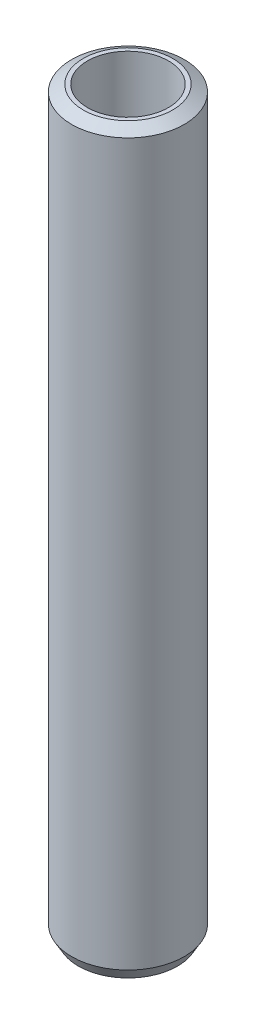
from build123d import *
from OCP.BRepFilletAPI import BRepFilletAPI_MakeChamfer

# Parameters (mm, degrees)
SKETCH1_R           = 20
BOSS_EXTRUDE1_DEPTH = 262.518422193
SKETCH2_R           = 14.389951416
CUT_EXTRUDE1_DEPTH  = 265.037728347
CHAMFER1_SIZE       = 2.379171202
CHAMFER1_SIZE2      = 4.120845402


with BuildPart() as part:
    # Sketch1 → Boss-Extrude1 (new body)
    with BuildSketch(Plane(origin=(0, 0, 0), x_dir=(1, 0, 0), z_dir=(0, 1, 0))):
        Circle(SKETCH1_R)
    extrude(amount=BOSS_EXTRUDE1_DEPTH)

    # Sketch2 → Cut-Extrude1 (cut, through all)
    with BuildSketch(Plane(origin=(0, 0, 0), x_dir=(1, 0, 0), z_dir=(0, 1, 0))):
        Circle(SKETCH2_R)
    extrude(amount=CUT_EXTRUDE1_DEPTH, mode=Mode.SUBTRACT)

    # Chamfer1: one chamfer whose edges measure the first distance from different faces: ONE call of the kernel's chamfer builder (chamfer() names one face for all edges)
    chamfer1_edges_1 = [part.edges().sort_by_distance(p)[0] for p in [
        (-20, 262.518422193, 0),
    ]]
    chamfer1_side_1 = [part.faces().sort_by_distance(p)[0] for p in [
        (-20, 131.259211096, 0),
    ]]
    chamfer1_edges_2 = [part.edges().sort_by_distance(p)[0] for p in [
        (-20, 0, 0),
    ]]
    chamfer1_side_2 = [part.faces().sort_by_distance(p)[0] for p in [
        (-19.434314575, 0, 0),
    ]]
    chamfer1 = BRepFilletAPI_MakeChamfer(part.part.solid().wrapped)
    for e in chamfer1_edges_1:
        chamfer1.Add(CHAMFER1_SIZE, CHAMFER1_SIZE2, e.wrapped, chamfer1_side_1[0].wrapped)  # the first distance lies on this face
    for e in chamfer1_edges_2:
        chamfer1.Add(CHAMFER1_SIZE, CHAMFER1_SIZE2, e.wrapped, chamfer1_side_2[0].wrapped)  # the first distance lies on this face
    add(Compound.cast(chamfer1.Shape()), mode=Mode.REPLACE)


solid = part.part
